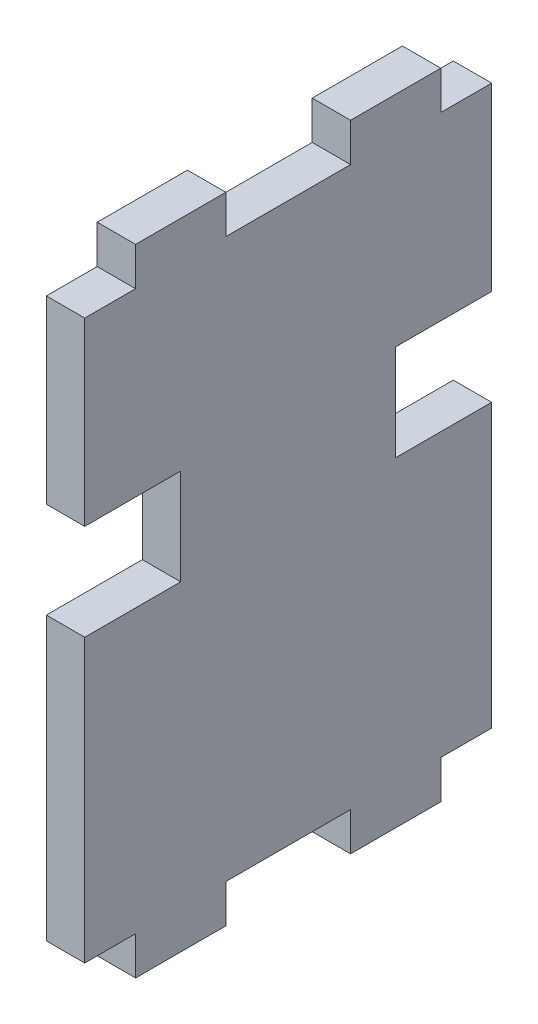
from build123d import *

# Parameters (mm, degrees)
SKETCH1_W                = 20
SKETCH1_H                = 50
BOSS_EXTRUDE2_DEPTH      = 4
CUT_EXTRUDE1_DEPTH       = 2
CUT_EXTRUDE2_DEPTH       = 55
CUT_EXTRUDE2_DEPTH_BACK  = 55
SKETCH8_W                = 64.236712081
SKETCH8_H                = 42.4
BOSS_EXTRUDE4_DEPTH      = 4
SKETCH9_R                = 1.7
CUT_EXTRUDE4_DEPTH       = 4
CUT_EXTRUDE5_START       = -4
SKETCH10_R               = 1.7
SKETCH10_W               = 53.236712081
SKETCH10_H               = 42.4
CUT_EXTRUDE5_DEPTH       = 4
SKETCH11_W               = 6
SKETCH11_H               = 42.4
BOSS_EXTRUDE5_DEPTH      = 62.2
SKETCH13_W               = 42.4
SKETCH13_H               = 4
BOSS_EXTRUDE6_DEPTH      = 30
SKETCH14_R               = 5
CUT_EXTRUDE6_DEPTH       = 30
CUT_EXTRUDE7_DEPTH       = 78.888381675
CUT_EXTRUDE7_DEPTH_BACK  = 78.888381675
SKETCH15_W               = 2
SKETCH15_H               = 66.2
CUT_EXTRUDE10_DEPTH      = 78.888381675
CUT_EXTRUDE10_DEPTH_BACK = 78.888381675
SKETCH18_W               = 32.847789041
SKETCH18_H               = 4
SKETCH18_W_2             = 47.634985267
SKETCH21_W               = 10
SKETCH21_H               = 10
CUT_EXTRUDE11_DEPTH      = 4
SKETCH19_W               = 4
SKETCH19_H               = 9.4
BOSS_EXTRUDE9_DEPTH      = 4
SKETCH20_W               = 4
SKETCH20_H               = 9.4
BOSS_EXTRUDE10_DEPTH     = 4


with BuildPart() as part:
    # Sketch1 → Boss-Extrude2 (new body)
    with BuildSketch(Plane(origin=(0, 0, 0), x_dir=(1, 0, 0), z_dir=(0, 1, 0))):
        with Locations((10, 25)):
            Rectangle(SKETCH1_W, SKETCH1_H)
    extrude(amount=BOSS_EXTRUDE2_DEPTH)

    # Sketch3 → Cut-Extrude1 (cut)
    with BuildSketch(Plane(origin=(0, 4, 0), x_dir=(1, 0, 0), z_dir=(0, 1, 0))):
        with BuildLine():
            Line((7.85, 10.95), (6.4, 25))
            Line((6.4, 25), (7.85, 39.05))
            ThreePointArc((7.85, 39.05), (10, 41.2), (12.15, 39.05))
            Line((12.15, 39.05), (13.6, 25))
            Line((13.6, 25), (12.15, 10.95))
            ThreePointArc((12.15, 10.95), (10, 8.8), (7.85, 10.95))
        make_face()
    extrude(amount=-CUT_EXTRUDE1_DEPTH, mode=Mode.SUBTRACT)

    # Sketch7 → Cut-Extrude2 (cut, two sides: drawn at the far end of the back side and taken through both)
    with BuildSketch(Plane(origin=(0, 4, 0), x_dir=(1, 0, 0), z_dir=(0, 1, 0)).offset(-CUT_EXTRUDE2_DEPTH_BACK)):
        with BuildLine():
            Line((17.114068962, 39.76590698), (18.6, 25))
            Line((18.6, 25), (17.114068962, 10.23409302))
            ThreePointArc((17.114068962, 10.23409302), (14.796027788, 5.647112348), (10, 3.8))
            Line((10, 3.8), (0, 3.8))
            Line((0, 3.8), (0, 0))
            Line((0, 0), (20, 0))
            Line((20, 0), (20, 50))
            Line((20, 50), (0, 50))
            Line((0, 50), (0, 46.2))
            Line((0, 46.2), (10, 46.2))
            ThreePointArc((10, 46.2), (14.796027788, 44.352887652), (17.114068962, 39.76590698))
        make_face()
    extrude(amount=CUT_EXTRUDE2_DEPTH + CUT_EXTRUDE2_DEPTH_BACK, mode=Mode.SUBTRACT)

    # Sketch8 → Boss-Extrude4 (add)
    with BuildSketch(Plane.XZ):
        with Locations((-32.118356041, -25)):
            Rectangle(SKETCH8_W, SKETCH8_H)
    extrude(amount=-BOSS_EXTRUDE4_DEPTH)

    # Sketch9 → Cut-Extrude4 (cut)
    with BuildSketch(Plane(origin=(0, 2, 0), x_dir=(1, 0, 0), z_dir=(0, 1, 0))):
        with Locations((10, 25)):
            Circle(SKETCH9_R)
    extrude(amount=-CUT_EXTRUDE4_DEPTH, mode=Mode.SUBTRACT)

    # Sketch10 → Cut-Extrude5 (cut)
    with BuildSketch(Plane.XZ.offset(CUT_EXTRUDE5_START)):
        with Locations((10, -25)):
            Circle(SKETCH10_R)
        with Locations((-37.618356041, -25)):
            Rectangle(SKETCH10_W, SKETCH10_H)
    extrude(amount=CUT_EXTRUDE5_DEPTH, mode=Mode.SUBTRACT)

    # Sketch11 → Boss-Extrude5 (add)
    with BuildSketch(Plane.XZ):
        with Locations((-8, -25)):
            Rectangle(SKETCH11_W, SKETCH11_H)
    extrude(amount=BOSS_EXTRUDE5_DEPTH)

    # Sketch13 → Boss-Extrude6 (add)
    with BuildSketch(Plane(origin=(-5, 0, 0), x_dir=(0, 0, -1), z_dir=(1, 0, 0))):
        with Locations((25, -60.2)):
            Rectangle(SKETCH13_W, SKETCH13_H)
    extrude(amount=BOSS_EXTRUDE6_DEPTH)

    # Sketch14 → Cut-Extrude6 (cut)
    with BuildSketch(Plane(origin=(0, -58.2, 0), x_dir=(1, 0, 0), z_dir=(0, 1, 0))):
        with BuildLine():
            Line((15.30974635, 16.526122865), (-5, 3.8))
            Line((-5, 3.8), (25, 3.8))
            Line((25, 3.8), (25, 46.2))
            Line((25, 46.2), (-5, 46.2))
            Line((-5, 46.2), (15.30974635, 33.473877135))
            ThreePointArc((15.30974635, 33.473877135), (20, 25), (15.30974635, 16.526122865))
        make_face()
        with Locations((10, 25)):
            Circle(SKETCH14_R)
    extrude(amount=-CUT_EXTRUDE6_DEPTH, mode=Mode.SUBTRACT)

    # Sketch15 → Cut-Extrude7 (cut, two sides: drawn at the far end of the back side and taken through both)
    with BuildSketch(Plane.XY.offset(-3.8).offset(-CUT_EXTRUDE7_DEPTH_BACK)):
        with Locations((-10, -29.1)):
            Rectangle(SKETCH15_W, SKETCH15_H)
    extrude(amount=CUT_EXTRUDE7_DEPTH + CUT_EXTRUDE7_DEPTH_BACK, mode=Mode.SUBTRACT)

    # Sketch18 → Cut-Extrude10 (cut, two sides: drawn at the far end of the back side and taken through both)
    with BuildSketch(Plane.XY.offset(-3.8).offset(-CUT_EXTRUDE10_DEPTH_BACK)):
        with Locations((7.423894521, 2)):
            Rectangle(SKETCH18_W, SKETCH18_H)
        with Locations((14.817492634, -60.2)):
            Rectangle(SKETCH18_W_2, SKETCH18_H)
    extrude(amount=CUT_EXTRUDE10_DEPTH + CUT_EXTRUDE10_DEPTH_BACK, mode=Mode.SUBTRACT)

    # Sketch21 → Cut-Extrude11 (cut)
    with BuildSketch(Plane(origin=(-5, 0, 0), x_dir=(0, 0, -1), z_dir=(1, 0, 0))):
        with Locations((41.2, -23.8)):
            Rectangle(SKETCH21_W, SKETCH21_H)
        with Locations((8.8, -23.8)):
            Rectangle(SKETCH21_W, SKETCH21_H)
    extrude(amount=-CUT_EXTRUDE11_DEPTH, mode=Mode.SUBTRACT)

    # Sketch19 → Boss-Extrude9 (add)
    with BuildSketch(Plane(origin=(0, 0, 0), x_dir=(1, 0, 0), z_dir=(0, 1, 0))):
        with Locations((-7, 36.2)):
            Rectangle(SKETCH19_W, SKETCH19_H)
        with Locations((-7, 13.8)):
            Rectangle(SKETCH19_W, SKETCH19_H)
    extrude(amount=BOSS_EXTRUDE9_DEPTH)

    # Sketch20 → Boss-Extrude10 (add)
    with BuildSketch(Plane.XZ.offset(58.2)):
        with Locations((-7, -13.8)):
            Rectangle(SKETCH20_W, SKETCH20_H)
        with Locations((-7, -36.2)):
            Rectangle(SKETCH20_W, SKETCH20_H)
    extrude(amount=BOSS_EXTRUDE10_DEPTH)


solid = part.part
